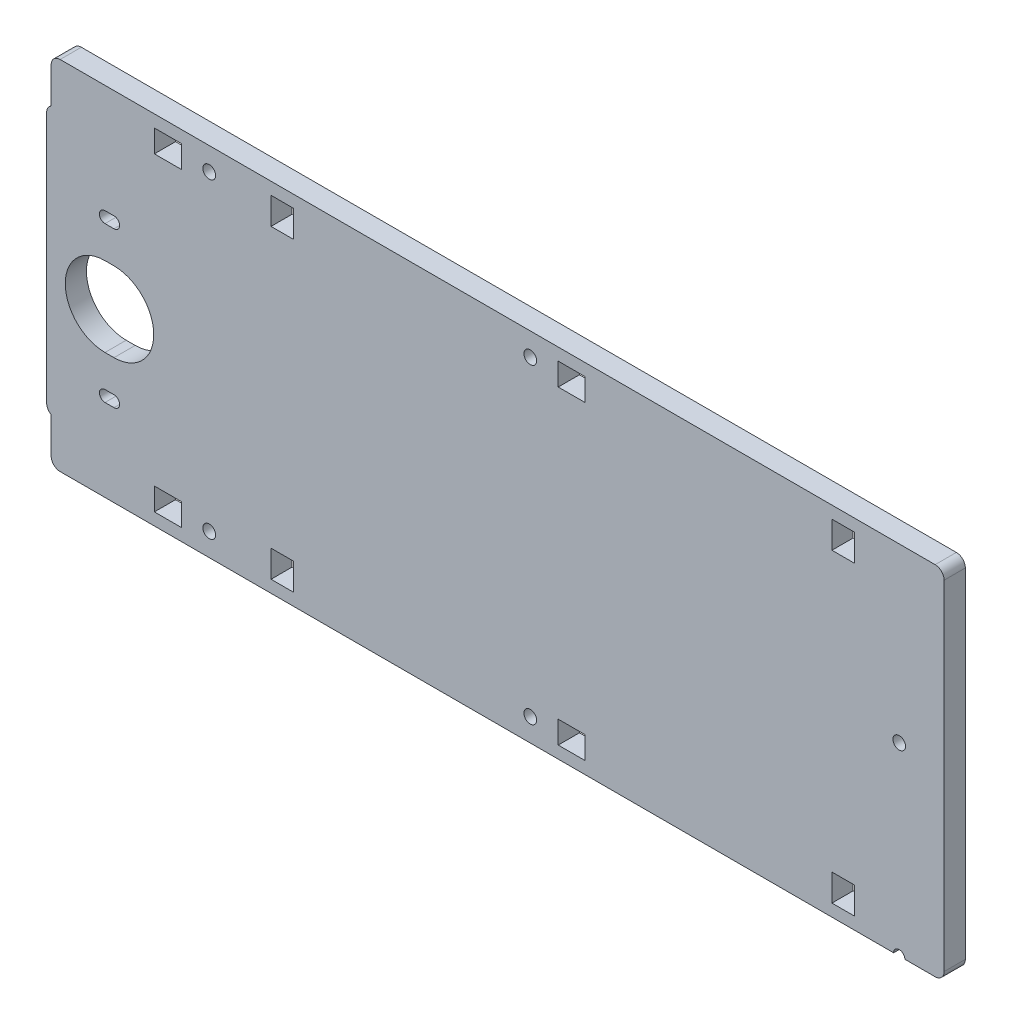
from build123d import *

# Parameters (mm, degrees)
SKETCH1_W           = 254
SKETCH1_H           = 101.0158
SKETCH1_W_2         = 6.35
SKETCH1_H_2         = 7.62
BOSS_EXTRUDE1_DEPTH = 6
SKETCH2_R           = 1.778
CUT_EXTRUDE1_DEPTH  = 274.415785663
SKETCH3_W           = 7.62
SKETCH3_H           = 6
CUT_EXTRUDE2_DEPTH  = 274.415785663
CUT_EXTRUDE3_REACH  = 275.416
SKETCH4_W           = 7.62
SKETCH4_H           = 0.35
SKETCH8_W           = 1.27
SKETCH8_H           = 12.7
CUT_EXTRUDE6_DEPTH  = 274.415785663
FILLET1_R           = 2.54
SKETCH6_R           = 1.8034
CUT_EXTRUDE4_DEPTH  = 274.415785663
SKETCH7_R           = 1.5875
CUT_EXTRUDE5_DEPTH  = 274.415785663


with BuildPart() as part:
    # Sketch1 → Boss-Extrude1 (new body)
    with BuildSketch(Plane.XY):
        with Locations((127, 50.5079)):
            Rectangle(SKETCH1_W, SKETCH1_H)
        with Locations((225.425, 93.7514)):
            Rectangle(SKETCH1_W_2, SKETCH1_H_2, mode=Mode.SUBTRACT)
        with Locations((66.675, 93.7514)):
            Rectangle(SKETCH1_W_2, SKETCH1_H_2, mode=Mode.SUBTRACT)
        with Locations((225.425, 7.2644)):
            Rectangle(SKETCH1_W_2, SKETCH1_H_2, mode=Mode.SUBTRACT)
        with Locations((66.675, 7.2644)):
            Rectangle(SKETCH1_W_2, SKETCH1_H_2, mode=Mode.SUBTRACT)
    extrude(amount=BOSS_EXTRUDE1_DEPTH)

    # Sketch2 → Cut-Extrude1 (cut, through all)
    with BuildSketch(Plane.XY.offset(6)):
        with Locations((241.3, 52.2605)):
            Circle(SKETCH2_R)
        with BuildLine():
            Line((16.51, 70.307310217), (19.05, 70.307310217))
            ThreePointArc((19.05, 70.307310217), (20.6375, 68.719810217), (19.05, 67.132310217))
            Line((19.05, 67.132310217), (16.51, 67.132310217))
            ThreePointArc((16.51, 67.132310217), (14.9225, 68.719810217), (16.51, 70.307310217))
        make_face()
        with BuildLine():
            Line((16.51, 26.466689783), (19.05, 26.466689783))
            ThreePointArc((19.05, 26.466689783), (20.6375, 24.879189783), (19.05, 23.291689783))
            Line((19.05, 23.291689783), (16.51, 23.291689783))
            ThreePointArc((16.51, 23.291689783), (14.9225, 24.879189783), (16.51, 26.466689783))
        make_face()
        with BuildLine():
            Line((16.51, 58.0495), (19.05, 58.0495))
            ThreePointArc((19.05, 58.0495), (30.3, 46.7995), (19.05, 35.5495))
            Line((19.05, 35.5495), (16.51, 35.5495))
            ThreePointArc((16.51, 35.5495), (5.26, 46.7995), (16.51, 58.0495))
        make_face()
    extrude(amount=-CUT_EXTRUDE1_DEPTH, mode=Mode.SUBTRACT)

    # Sketch3 → Cut-Extrude2 (cut, through all)
    with BuildSketch(Plane.XY.offset(6)):
        with Locations((34.29, 94.5614)):
            Rectangle(SKETCH3_W, SKETCH3_H)
        with Locations((148.59, 94.5614)):
            Rectangle(SKETCH3_W, SKETCH3_H)
        with Locations((148.59, 6.4544)):
            Rectangle(SKETCH3_W, SKETCH3_H)
        with Locations((34.29, 6.4544)):
            Rectangle(SKETCH3_W, SKETCH3_H)
    extrude(amount=-CUT_EXTRUDE2_DEPTH, mode=Mode.SUBTRACT)

    # Sketch4 → Cut-Extrude3 (cut, up to next)
    with BuildSketch(Plane.XY.offset(6), mode=Mode.PRIVATE) as cut_extrude3_sk1:
        with Locations((34.29, 91.3864)):
            Rectangle(SKETCH4_W, SKETCH4_H)
    cut_extrude3_tool1 = extrude(cut_extrude3_sk1.sketch, amount=-CUT_EXTRUDE3_REACH, mode=Mode.PRIVATE) & part.part
    # Sketch4 → Cut-Extrude3 (cut, up to next)
    with BuildSketch(Plane.XY.offset(6), mode=Mode.PRIVATE) as cut_extrude3_sk2:
        with Locations((34.29, 9.6294)):
            Rectangle(SKETCH4_W, SKETCH4_H)
    cut_extrude3_tool2 = extrude(cut_extrude3_sk2.sketch, amount=-CUT_EXTRUDE3_REACH, mode=Mode.PRIVATE) & part.part
    # Sketch4 → Cut-Extrude3 (cut, up to next)
    with BuildSketch(Plane.XY.offset(6), mode=Mode.PRIVATE) as cut_extrude3_sk3:
        with Locations((148.59, 91.3864)):
            Rectangle(SKETCH4_W, SKETCH4_H)
    cut_extrude3_tool3 = extrude(cut_extrude3_sk3.sketch, amount=-CUT_EXTRUDE3_REACH, mode=Mode.PRIVATE) & part.part
    # Sketch4 → Cut-Extrude3 (cut, up to next)
    with BuildSketch(Plane.XY.offset(6), mode=Mode.PRIVATE) as cut_extrude3_sk4:
        with Locations((148.59, 9.6294)):
            Rectangle(SKETCH4_W, SKETCH4_H)
    cut_extrude3_tool4 = extrude(cut_extrude3_sk4.sketch, amount=-CUT_EXTRUDE3_REACH, mode=Mode.PRIVATE) & part.part
    add(cut_extrude3_tool1.solids().sort_by_distance((34.29, 91.3864, 6))[0], mode=Mode.SUBTRACT)
    add(cut_extrude3_tool2.solids().sort_by_distance((34.29, 9.6294, 6))[0], mode=Mode.SUBTRACT)
    add(cut_extrude3_tool3.solids().sort_by_distance((148.59, 91.3864, 6))[0], mode=Mode.SUBTRACT)
    add(cut_extrude3_tool4.solids().sort_by_distance((148.59, 9.6294, 6))[0], mode=Mode.SUBTRACT)

    # Sketch8 → Cut-Extrude6 (cut, through all)
    with BuildSketch(Plane.XY.offset(6)):
        with Locations((0.635, 94.6658)):
            Rectangle(SKETCH8_W, SKETCH8_H)
        with Locations((0.635, 6.35)):
            Rectangle(SKETCH8_W, SKETCH8_H)
    extrude(amount=-CUT_EXTRUDE6_DEPTH, mode=Mode.SUBTRACT)

    # Fillet1
    # the kernel refuses this fillet: 2.54 mm, written as the material it takes off along each edge
    with BuildSketch(Plane(origin=(254, 0, -6.35), x_dir=(-1, 0, 0), z_dir=(0, 0, 1)), Plane(origin=(254, 101.0158, -6.35), x_dir=(0, -1, 0), z_dir=(0, 0, 1)), Plane(origin=(1.27, 0, 12.35), x_dir=(1, 0, 0), z_dir=(0, 0, -1)), Plane(origin=(1.27, 101.0158, 12.35), x_dir=(0, -1, 0), z_dir=(0, 0, -1))) as fillet1_piece_1:
        with BuildLine():
            CenterArc((FILLET1_R, -FILLET1_R), FILLET1_R, 90, 90)
            Line((0, -FILLET1_R), (-FILLET1_R * 0.02, -FILLET1_R))
            Line((-FILLET1_R * 0.02, -FILLET1_R), (-FILLET1_R * 0.02, FILLET1_R * 0.02))
            Line((-FILLET1_R * 0.02, FILLET1_R * 0.02), (FILLET1_R, FILLET1_R * 0.02))
            Line((FILLET1_R, FILLET1_R * 0.02), (FILLET1_R, 0))
        make_face()
    extrude(amount=18.7, mode=Mode.SUBTRACT)
    with BuildSketch(Plane(origin=(0, 88.3158, 11.499261314), x_dir=(0, -1, 0), z_dir=(0, 0, -1))) as fillet1_piece_2:
        with BuildLine():
            CenterArc((2.199704526, -2.54), FILLET1_R, 90, 60)
            Line((0, -1.27), (-0.043994091, -1.2446))
            ThreePointArc((-0.043994091, -1.2446), (-0.0508, -0.635), (-0.0508, 0))
            Line((-0.0508, 0), (0, 0.0508))
            Line((0, 0.0508), (2.199704526, 0.0508))
            Line((2.199704526, 0.0508), (2.199704526, 0))
        make_face()
    extrude(amount=16.998522628, mode=Mode.SUBTRACT)
    with BuildSketch(Plane(origin=(0, 12.7, 11.499261314), x_dir=(1, 0, 0), z_dir=(0, 0, -1))) as fillet1_piece_3:
        with BuildLine():
            CenterArc((2.54, -2.199704526), FILLET1_R, 120, 60)
            Line((0, -2.199704526), (-0.0508, -2.199704526))
            Line((-0.0508, -2.199704526), (-0.0508, 0))
            Line((-0.0508, 0), (0, 0.0508))
            ThreePointArc((0, 0.0508), (0.635, 0.0508), (1.2446, 0.043994091))
            Line((1.2446, 0.043994091), (1.27, 0))
        make_face()
    extrude(amount=16.998522628, mode=Mode.SUBTRACT)

    # Sketch6 → Cut-Extrude4 (cut, through all)
    with BuildSketch(Plane.XY.offset(6)):
        with Locations((46.0121, 6.4544)):
            Circle(SKETCH6_R)
        with Locations((136.8679, 6.4544)):
            Circle(SKETCH6_R)
        with Locations((46.0121, 94.5614)):
            Circle(SKETCH6_R)
        with Locations((136.8679, 94.5614)):
            Circle(SKETCH6_R)
    extrude(amount=-CUT_EXTRUDE4_DEPTH, mode=Mode.SUBTRACT)

    # Sketch7 → Cut-Extrude5 (cut, through all)
    with BuildSketch(Plane.XY.offset(6)):
        with Locations((241.3, 0)):
            Circle(SKETCH7_R)
    extrude(amount=-CUT_EXTRUDE5_DEPTH, mode=Mode.SUBTRACT)


solid = part.part
